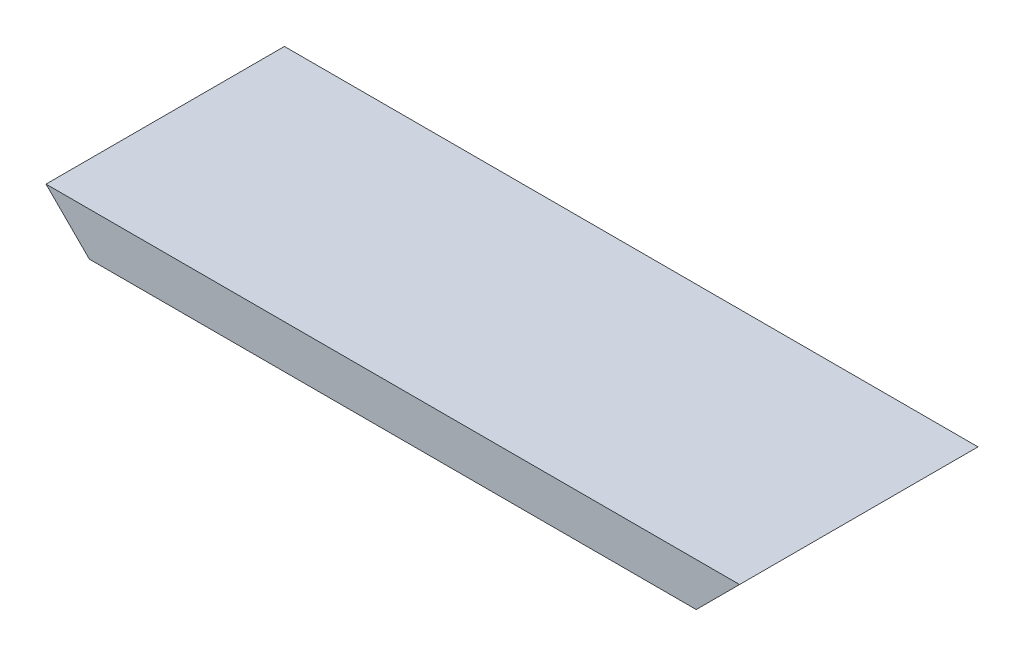
from build123d import *

# Parameters (mm, degrees)
SKETCH2_W           = 203.2
SKETCH2_H           = 12.7
BOSS_EXTRUDE1_DEPTH = 69.85
CHAMFER1_SIZE       = 12.7
SKETCH3_W           = 203.2
SKETCH3_H           = 3.175
SKETCH3_H_2         = 3.000000096
CUT_EXTRUDE2_DEPTH  = 3.175


with BuildPart() as part:
    # Sketch2 → Boss-Extrude1 (new body)
    with BuildSketch(Plane.XY):
        Rectangle(SKETCH2_W, SKETCH2_H)
    extrude(amount=BOSS_EXTRUDE1_DEPTH)

    # Chamfer1
    chamfer1_edges = [part.edges().sort_by_distance(p)[0] for p in [
        (-101.6, -6.35, 34.925),
        (101.6, -6.35, 34.925),
    ]]
    chamfer(chamfer1_edges, length=CHAMFER1_SIZE - 0.0001)  # a hair under: the kernel refuses the full size

    # Sketch3 → Cut-Extrude2 (cut)
    with BuildSketch(Plane.XZ.offset(6.35)):
        with Locations((0, 65.0875)):
            Rectangle(SKETCH3_W, SKETCH3_H)
        with Locations((0, 4.675000048)):
            Rectangle(SKETCH3_W, SKETCH3_H_2)
        with Locations((0, 55.649999952)):
            Rectangle(SKETCH3_W, SKETCH3_H_2)
    extrude(amount=-CUT_EXTRUDE2_DEPTH, mode=Mode.SUBTRACT)


solid = part.part
